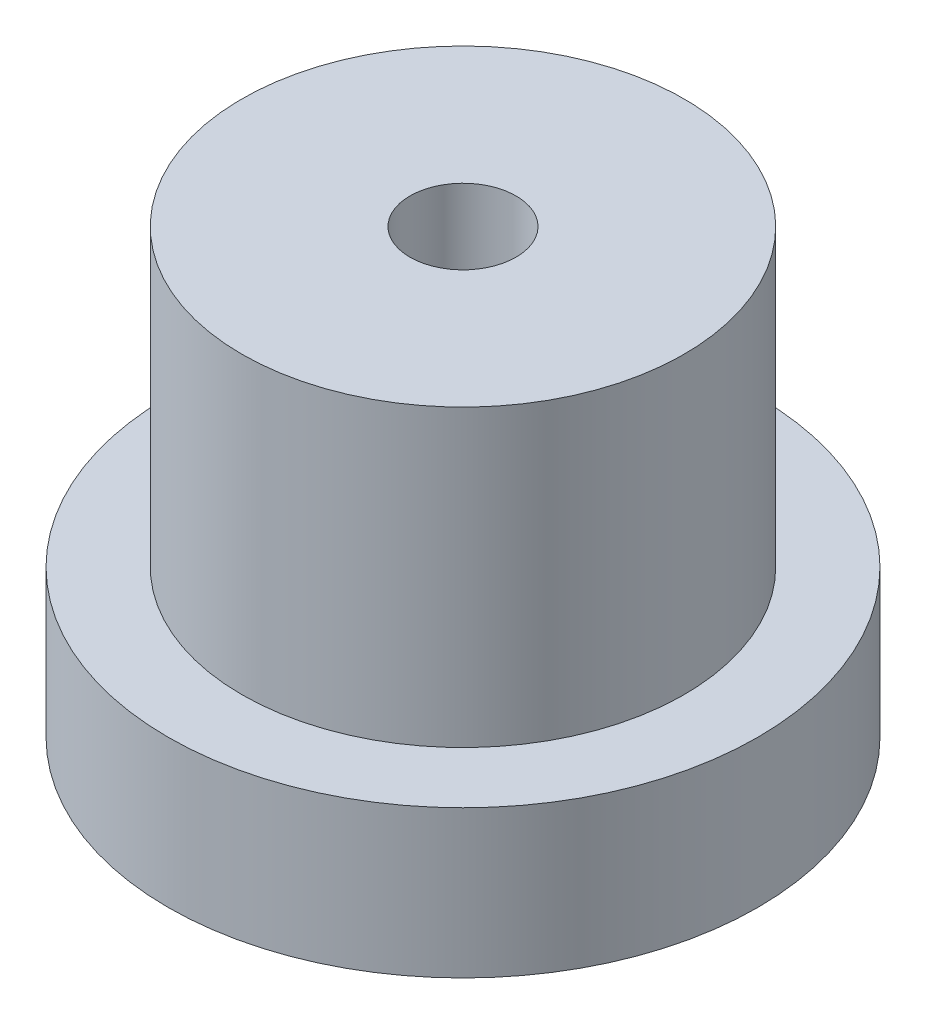
from build123d import *

# Parameters (mm, degrees)
SKETCH_1_R        = 10
EXTRUDE_1_DEPTH   = 5
SKETCH_2_R        = 7.5
EXTRUDE_2_DEPTH   = 10
OTHER_START       = 5
OTHER_1_OUTLINE_R = 1.8
OTHER_1_DEPTH     = 10


# Read off the part's stored shape, not the designer's step: 高级异型孔1
with BuildPart() as part:
    # 草图1 → 凸台-拉伸1 (new body)
    with BuildSketch(Plane(origin=(0, 0, 0), x_dir=(1, 0, 0), z_dir=(0, 1, 0))):
        with Locations(Location((0, 0, 0), (0, 0, 270))):
            Circle(SKETCH_1_R)
    extrude(amount=EXTRUDE_1_DEPTH)

    # 草图2 → 凸台-拉伸2 (add)
    with BuildSketch(Plane(origin=(0, 5, 0), x_dir=(1, 0, 0), z_dir=(0, 1, 0))):
        with Locations(Location((0, 0, 0), (0, 0, 270))):
            Circle(SKETCH_2_R)
    extrude(amount=EXTRUDE_2_DEPTH)

    # 高级异型孔1 outline → 高级异型孔1 (cut)
    with BuildSketch(Plane(origin=(0, 0, 0), x_dir=(1, 0, 0), z_dir=(0, 1, 0)).offset(OTHER_START)):
        Circle(OTHER_1_OUTLINE_R)
    extrude(amount=OTHER_1_DEPTH, mode=Mode.SUBTRACT)


solid = part.part
